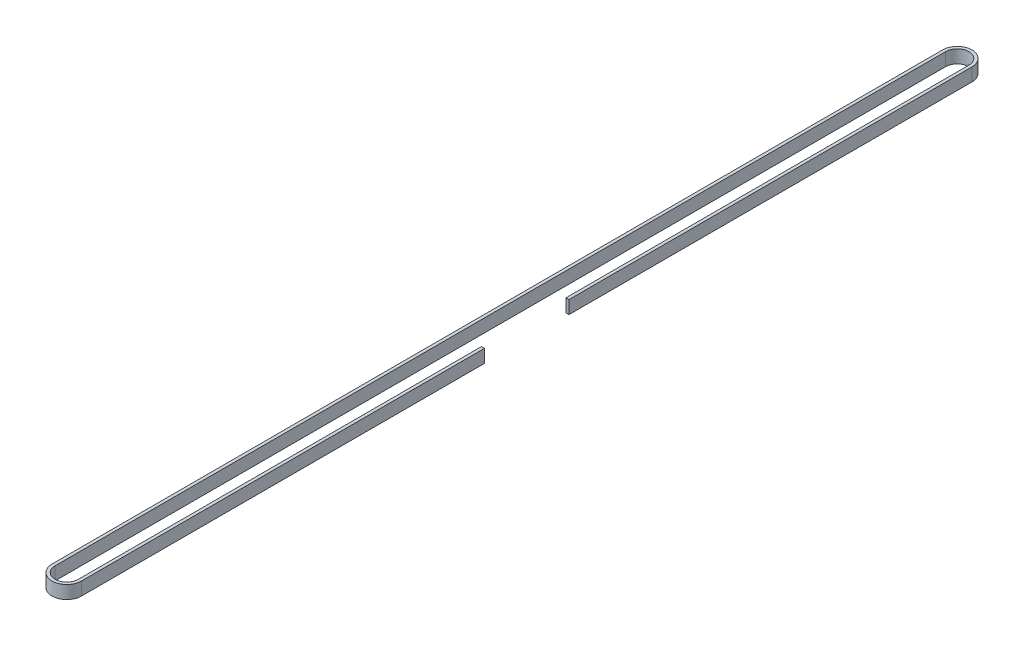
from build123d import *

# Parameters (mm, degrees)
EXTRUDE_THIN1_DEPTH = 6


with BuildPart() as part:
    # Sketch1 → Extrude-Thin1 (new body)
    with BuildSketch(Plane(origin=(0, 0, 0), x_dir=(1, 0, 0), z_dir=(0, 1, 0))):
        with BuildLine():
            Line((355.746, -109.767481844), (355.746, -294.767481844))
            ThreePointArc((355.746, -294.767481844), (350.38, -300.133481844), (345.014, -294.767481844))
            Line((345.014, -294.767481844), (345.014, 113.982518156))
            ThreePointArc((345.014, 113.982518156), (350.38, 119.348518156), (355.746, 113.982518156))
            Line((355.746, 113.982518156), (355.746, -71.017481844))
            Line((355.746, -71.017481844), (357.126, -71.017481844))
            Line((357.126, -71.017481844), (357.126, 113.982518156))
            ThreePointArc((357.126, 113.982518156), (350.38, 120.728518156), (343.634, 113.982518156))
            Line((343.634, 113.982518156), (343.634, -294.767481844))
            ThreePointArc((343.634, -294.767481844), (350.38, -301.513481844), (357.126, -294.767481844))
            Line((357.126, -294.767481844), (357.126, -109.767481844))
            Line((357.126, -109.767481844), (355.746, -109.767481844))
        make_face()
    extrude(amount=EXTRUDE_THIN1_DEPTH)


solid = part.part
